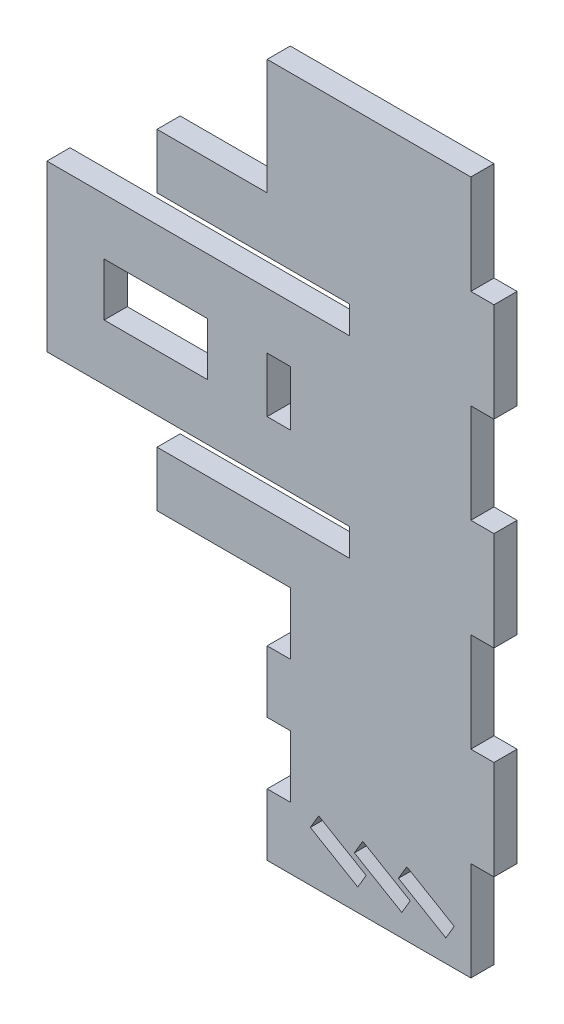
from build123d import *

# Parameters (mm, degrees)
SKETCH1_W           = 52.324
SKETCH1_H           = 160.02
BOSS_EXTRUDE1_DEPTH = 5.334
SKETCH2_W           = 5.334
SKETCH2_H           = 22.86
CUT_EXTRUDE1_DEPTH  = 115.417820658
SKETCH3_W           = 5.334
SKETCH3_H           = 38.1
BOSS_EXTRUDE2_DEPTH = 50.8
SKETCH4_W           = 23.876
SKETCH4_H           = 12.192
CUT_EXTRUDE2_DEPTH  = 151.047185381
SKETCH5_W           = 19.05
SKETCH5_H           = 6.35
CUT_EXTRUDE3_DEPTH  = 151.047185381
SKETCH6_W           = 5.334
SKETCH6_H           = 12.7
BOSS_EXTRUDE3_DEPTH = 25.4
SKETCH7_W           = 5.334
SKETCH7_H           = 12.7
BOSS_EXTRUDE4_DEPTH = 25.4
SKETCH8_W           = 5.334
SKETCH8_H           = 14.2875
CUT_EXTRUDE4_DEPTH  = 151.047185381
SKETCH9_W           = 5.334
SKETCH9_H           = 12.7
CUT_EXTRUDE5_DEPTH  = 151.047185381
CUT_EXTRUDE6_DEPTH  = 151.047185381


with BuildPart() as part:
    # Sketch1 → Boss-Extrude1 (new body)
    with BuildSketch(Plane.XY):
        with Locations((-41.181308627, -12.336439624)):
            Rectangle(SKETCH1_W, SKETCH1_H)
    extrude(amount=BOSS_EXTRUDE1_DEPTH)

    # Sketch2 → Cut-Extrude1 (cut, through all)
    with BuildSketch(Plane.XY.offset(5.334)):
        with Locations((-17.686308627, 56.243560376)):
            Rectangle(SKETCH2_W, SKETCH2_H)
        with Locations((-17.686308627, 10.523560376)):
            Rectangle(SKETCH2_W, SKETCH2_H)
        with Locations((-17.686308627, -35.196439624)):
            Rectangle(SKETCH2_W, SKETCH2_H)
        with Locations((-17.686308627, -80.916439624)):
            Rectangle(SKETCH2_W, SKETCH2_H)
    extrude(amount=-CUT_EXTRUDE1_DEPTH, mode=Mode.SUBTRACT)

    # Sketch3 → Boss-Extrude2 (add)
    with BuildSketch(Plane.ZY.offset(67.343308627)):
        with Locations((2.667, 2.903560376)):
            Rectangle(SKETCH3_W, SKETCH3_H)
    extrude(amount=BOSS_EXTRUDE2_DEPTH)

    # Sketch4 → Cut-Extrude2 (cut, through all)
    with BuildSketch(Plane.XY.offset(5.334)):
        with Locations((-92.997308627, 2.903560376)):
            Rectangle(SKETCH4_W, SKETCH4_H)
    extrude(amount=-CUT_EXTRUDE2_DEPTH, mode=Mode.SUBTRACT)

    # Sketch5 → Cut-Extrude3 (cut, through all)
    with BuildSketch(Plane.XY.offset(5.334)):
        with Locations((-57.818308627, 25.128560376)):
            Rectangle(SKETCH5_W, SKETCH5_H)
        with Locations((-57.818308627, -19.321439624)):
            Rectangle(SKETCH5_W, SKETCH5_H)
    extrude(amount=-CUT_EXTRUDE3_DEPTH, mode=Mode.SUBTRACT)

    # Sketch6 → Boss-Extrude3 (add)
    with BuildSketch(Plane.ZY.offset(67.343308627)):
        with Locations((2.667, 34.653560376)):
            Rectangle(SKETCH6_W, SKETCH6_H)
    extrude(amount=BOSS_EXTRUDE3_DEPTH)

    # Sketch7 → Boss-Extrude4 (add)
    with BuildSketch(Plane.ZY.offset(67.343308627)):
        with Locations((2.667, -28.846439624)):
            Rectangle(SKETCH7_W, SKETCH7_H)
    extrude(amount=BOSS_EXTRUDE4_DEPTH)

    # Sketch8 → Cut-Extrude4 (cut, through all)
    with BuildSketch(Plane.XY.offset(5.334)):
        with Locations((-64.676308627, -42.340189624)):
            Rectangle(SKETCH8_W, SKETCH8_H)
        with Locations((-64.676308627, -70.915189624)):
            Rectangle(SKETCH8_W, SKETCH8_H)
    extrude(amount=-CUT_EXTRUDE4_DEPTH, mode=Mode.SUBTRACT)

    # Sketch9 → Cut-Extrude5 (cut, through all)
    with BuildSketch(Plane.XY.offset(5.334)):
        with Locations((-64.676308627, 2.649560376)):
            Rectangle(SKETCH9_W, SKETCH9_H)
    extrude(amount=-CUT_EXTRUDE5_DEPTH, mode=Mode.SUBTRACT)

    # Sketch10 → Cut-Extrude6 (cut, through all)
    with BuildSketch(Plane.XY.offset(5.334)):
        Polygon((-57.379441561, -80.781874862), (-46.432343901, -87.220124068), (-44.50086914, -83.93599477), (-55.447966799, -77.497745564), align=None)
        Polygon((-45.287966799, -77.497745564), (-34.34086914, -83.93599477), (-36.272343901, -87.220124068), (-47.219441561, -80.781874862), align=None)
        Polygon((-35.127966799, -77.497745564), (-24.18086914, -83.93599477), (-26.112343901, -87.220124068), (-37.059441561, -80.781874862), align=None)
    extrude(amount=-CUT_EXTRUDE6_DEPTH, mode=Mode.SUBTRACT)


solid = part.part
